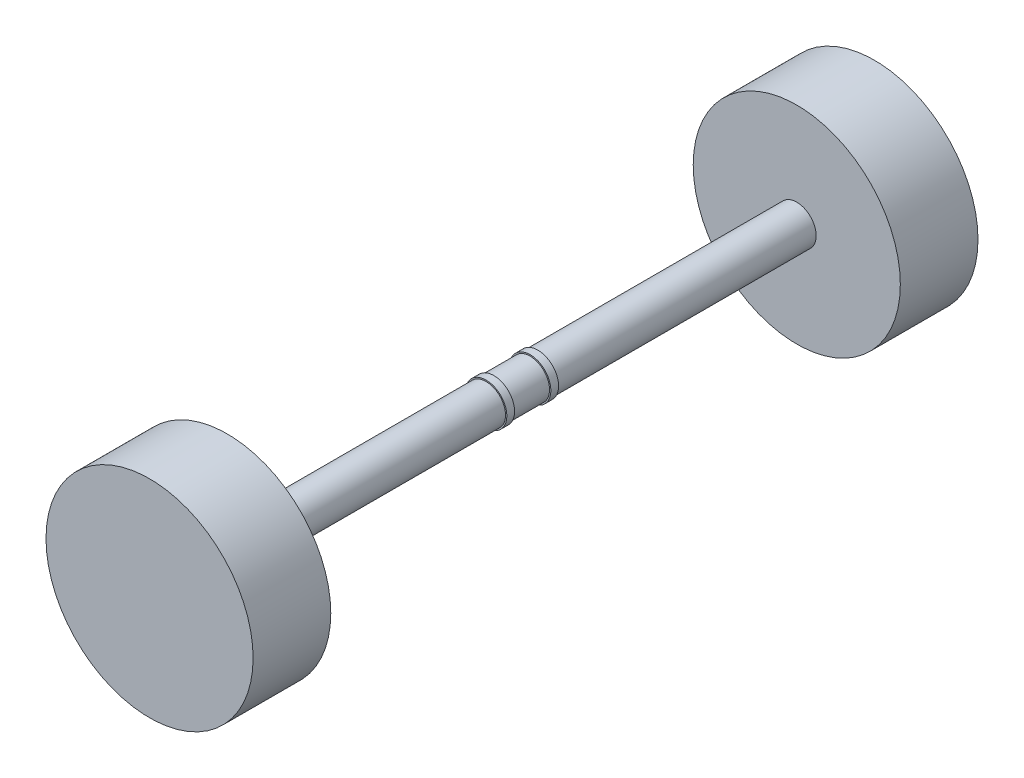
from build123d import *

# Parameters (mm, degrees)
SKETCH2_R               = 101.6
BOSS_EXTRUDE1_DEPTH     = 76.2
SKETCH3_R               = 19.05
BOSS_EXTRUDE2_DEPTH     = 330.2
SKETCH12_R              = 20.32
BOSS_EXTRUDE5_DEPTH     = 7.62
BOSS_EXTRUDE6_OUTLINE_R = 19.05
BOSS_EXTRUDE6_DEPTH     = 35.56
SKETCH14_R              = 20.32
BOSS_EXTRUDE7_DEPTH     = 7.62
BOSS_EXTRUDE8_OUTLINE_R = 19.05
BOSS_EXTRUDE8_DEPTH     = 254
SKETCH16_R              = 101.6
BOSS_EXTRUDE9_DEPTH     = 76.2


# Read off the part's stored shape, not the designer's step: Boss-Extrude6, Boss-Extrude8
with BuildPart() as part:
    # Sketch2 → Boss-Extrude1 (new body)
    with BuildSketch(Plane.XY):
        with Locations(Location((0, 0, 0), (0, 0, 180))):
            Circle(SKETCH2_R)
    extrude(amount=BOSS_EXTRUDE1_DEPTH)

    # Sketch3 → Boss-Extrude2 (add)
    with BuildSketch(Plane.XY):
        Circle(SKETCH3_R)
    extrude(amount=BOSS_EXTRUDE2_DEPTH)

    # Sketch12 → Boss-Extrude5 (add)
    with BuildSketch(Plane.XY.offset(330.2)):
        with Locations(Location((0, 0, 0), (0, 0, 180))):
            Circle(SKETCH12_R)
    extrude(amount=BOSS_EXTRUDE5_DEPTH)

    # Boss-Extrude6 outline → Boss-Extrude6 (add)
    with BuildSketch(Plane.XY.offset(337.82)):
        Circle(BOSS_EXTRUDE6_OUTLINE_R)
    extrude(amount=BOSS_EXTRUDE6_DEPTH)

    # Sketch14 → Boss-Extrude7 (add)
    with BuildSketch(Plane.XY.offset(373.38)):
        with Locations(Location((0, 0, 0), (0, 0, 180))):
            Circle(SKETCH14_R)
    extrude(amount=BOSS_EXTRUDE7_DEPTH)

    # Boss-Extrude8 outline → Boss-Extrude8 (add)
    with BuildSketch(Plane.XY.offset(381)):
        Circle(BOSS_EXTRUDE8_OUTLINE_R)
    extrude(amount=BOSS_EXTRUDE8_DEPTH)

    # Sketch16 → Boss-Extrude9 (add)
    with BuildSketch(Plane.XY.offset(635)):
        with Locations(Location((0, 0, 0), (0, 0, 180))):
            Circle(SKETCH16_R)
    extrude(amount=BOSS_EXTRUDE9_DEPTH)


solid = part.part
